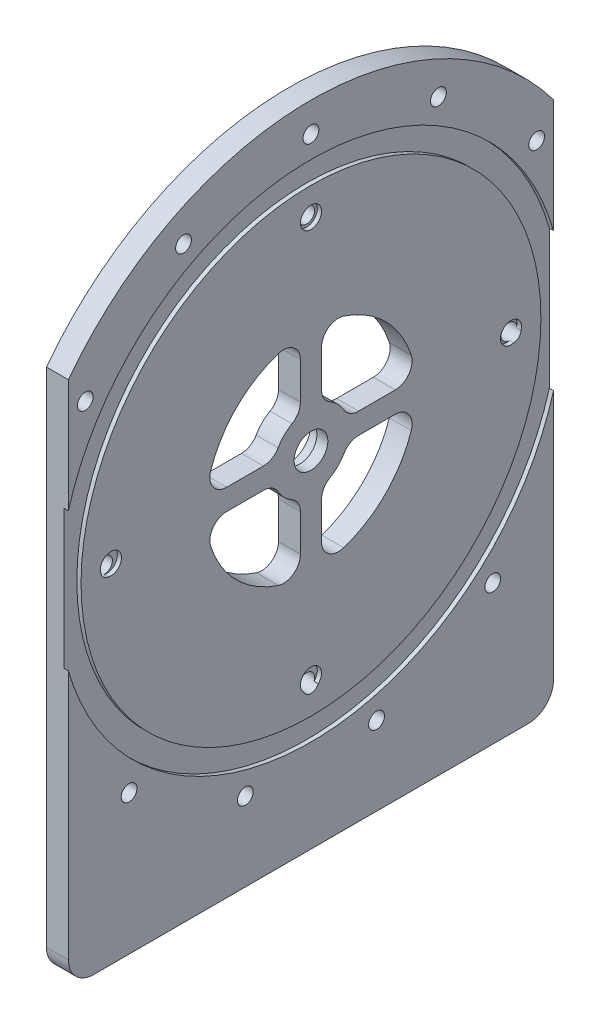
from build123d import *

# Parameters (mm, degrees)
SKETCH1_R           = 5.08
BOSS_EXTRUDE1_DEPTH = 6.604
SKETCH2_R           = 6.477
CUT_EXTRUDE1_DEPTH  = 3.302
SKETCH3_R           = 75.946
SKETCH3_R_2         = 69.215
CUT_EXTRUDE2_DEPTH  = 1.27
SKETCH4_R           = 2.38125
CUT_EXTRUDE3_DEPTH  = 139.530727768
SKETCH10_R          = 57.15
SKETCH10_R_2        = 50.8
CUT_EXTRUDE6_DEPTH  = 1.27
SKETCH12_R          = 2.38125
CUT_EXTRUDE7_DEPTH  = 139.530727768
SKETCH15_R          = 3.175
CUT_EXTRUDE11_DEPTH = 1.27
SKETCH16_W          = 32.206831535
SKETCH16_H          = 125.02997604
SKETCH16_W_2        = 34.902507441
CUT_EXTRUDE12_DEPTH = 139.530727768
CUT_EXTRUDE13_DEPTH = 128.130403763


with BuildPart() as part:
    # Sketch1 → Boss-Extrude1 (new body)
    with BuildSketch(Plane(origin=(0, 0, 0), x_dir=(0, 0, -1), z_dir=(1, 0, 0))):
        with BuildLine():
            Line((-65.405, -103.855072673), (65.405, -103.855072673))
            ThreePointArc((65.405, -103.855072673), (70.793153673, -101.623226346), (73.025, -96.235072673))
            Line((73.025, -96.235072673), (73.025, -69.997049759))
            ThreePointArc((73.025, -69.997049759), (74.696702219, -57.072253546), (79.601785714, -44.998103417))
            ThreePointArc((79.601785714, -44.998103417), (0, 91.44), (-79.601785714, -44.998103417))
            ThreePointArc((-79.601785714, -44.998103417), (-74.696702219, -57.072253546), (-73.025, -69.997049759))
            Line((-73.025, -69.997049759), (-73.025, -96.235072673))
            ThreePointArc((-73.025, -96.235072673), (-70.793153673, -101.623226346), (-65.405, -103.855072673))
        make_face()
        Circle(SKETCH1_R, mode=Mode.SUBTRACT)
    extrude(amount=BOSS_EXTRUDE1_DEPTH)

    # Sketch2 → Cut-Extrude1 (cut)
    with BuildSketch(Plane(origin=(0, 0, 0), x_dir=(0, 0, -1), z_dir=(1, 0, 0))):
        Circle(SKETCH2_R)
    extrude(amount=CUT_EXTRUDE1_DEPTH, mode=Mode.SUBTRACT)

    # Sketch3 → Cut-Extrude2 (cut)
    with BuildSketch(Plane(origin=(6.604, 0, 0), x_dir=(0, 0, -1), z_dir=(1, 0, 0))):
        Circle(SKETCH3_R)
        Circle(SKETCH3_R_2, mode=Mode.SUBTRACT)
    extrude(amount=-CUT_EXTRUDE2_DEPTH, mode=Mode.SUBTRACT)

    # Sketch4 → Cut-Extrude3 (cut, through all)
    with BuildSketch(Plane.ZY):
        with Locations((-38.362897852, 73.094394918)):
            Circle(SKETCH4_R)
        with Locations((0, 82.55)):
            Circle(SKETCH4_R)
        with Locations((38.362897852, 73.094394918)):
            Circle(SKETCH4_R)
        with Locations((67.93731813, 46.893744843)):
            Circle(SKETCH4_R)
        with Locations((81.948117557, 9.950302955)):
            Circle(SKETCH4_R)
        with Locations((77.185590834, -29.272633425)):
            Circle(SKETCH4_R)
        with Locations((54.740775438, -61.789562262)):
            Circle(SKETCH4_R)
        with Locations((19.755508087, -80.151247029)):
            Circle(SKETCH4_R)
        with Locations((-19.755508087, -80.151247029)):
            Circle(SKETCH4_R)
        with Locations((-54.740775438, -61.789562262)):
            Circle(SKETCH4_R)
        with Locations((-77.185590834, -29.272633425)):
            Circle(SKETCH4_R)
        with Locations((-81.948117557, 9.950302955)):
            Circle(SKETCH4_R)
        with Locations((-67.93731813, 46.893744843)):
            Circle(SKETCH4_R)
    extrude(amount=-CUT_EXTRUDE3_DEPTH, mode=Mode.SUBTRACT)

    # Sketch10 → Cut-Extrude6 (cut)
    with BuildSketch(Plane.ZY):
        Circle(SKETCH10_R)
        Circle(SKETCH10_R_2, mode=Mode.SUBTRACT)
    extrude(amount=-CUT_EXTRUDE6_DEPTH, mode=Mode.SUBTRACT)

    # Sketch12 → Cut-Extrude7 (cut, through all)
    with BuildSketch(Plane.ZY):
        with Locations((0, 60.874333344)):
            Circle(SKETCH12_R)
        with Locations((60.874333344, 0)):
            Circle(SKETCH12_R)
        with Locations((0, -60.874333344)):
            Circle(SKETCH12_R)
        with Locations((-60.874333344, 0)):
            Circle(SKETCH12_R)
    extrude(amount=-CUT_EXTRUDE7_DEPTH, mode=Mode.SUBTRACT)

    # Sketch15 → Cut-Extrude11 (cut)
    with BuildSketch(Plane(origin=(6.604, 0, 0), x_dir=(0, 0, -1), z_dir=(1, 0, 0))):
        with Locations((0, 60.874333344)):
            Circle(SKETCH15_R)
        with Locations((60.198, 0.676333344)):
            Circle(SKETCH15_R)
        with Locations((0, -59.521666656)):
            Circle(SKETCH15_R)
        with Locations((-60.198, 0.676333344)):
            Circle(SKETCH15_R)
    extrude(amount=-CUT_EXTRUDE11_DEPTH, mode=Mode.SUBTRACT)

    # Sketch16 → Cut-Extrude12 (cut, through all)
    with BuildSketch(Plane.ZY):
        with Locations((-89.128415768, -7.482061739)):
            Rectangle(SKETCH16_W, SKETCH16_H)
        with Locations((90.476253721, -7.482061739)):
            Rectangle(SKETCH16_W_2, SKETCH16_H)
    extrude(amount=-CUT_EXTRUDE12_DEPTH, mode=Mode.SUBTRACT)

    # Sketch18 → Cut-Extrude13 (cut, through all)
    with BuildSketch(Plane.ZY):
        with BuildLine():
            Line((25.360281446, 3.175), (14.298079416, 3.175))
            ThreePointArc((14.298079416, 3.175), (11.758079416, 3.855590949), (9.898670365, 5.715))
            ThreePointArc((9.898670365, 5.715), (8.082230509, 8.082230509), (5.715, 9.898670365))
            ThreePointArc((5.715, 9.898670365), (3.855590949, 11.758079416), (3.175, 14.298079416))
            Line((3.175, 14.298079416), (3.175, 25.360281446))
            ThreePointArc((3.175, 25.360281446), (5.270146171, 29.470883302), (9.827380952, 30.190811245))
            ThreePointArc((9.827380952, 30.190811245), (22.450640303, 22.450640303), (30.190811245, 9.827380952))
            ThreePointArc((30.190811245, 9.827380952), (29.470883302, 5.270146171), (25.360281446, 3.175))
        make_face()
        with BuildLine():
            Line((-3.175, 25.360281446), (-3.175, 14.298079416))
            ThreePointArc((-3.175, 14.298079416), (-3.855590949, 11.758079416), (-5.715, 9.898670365))
            ThreePointArc((-5.715, 9.898670365), (-8.082230509, 8.082230509), (-9.898670365, 5.715))
            ThreePointArc((-9.898670365, 5.715), (-11.758079416, 3.855590949), (-14.298079416, 3.175))
            Line((-14.298079416, 3.175), (-25.360281446, 3.175))
            ThreePointArc((-25.360281446, 3.175), (-29.470883302, 5.270146171), (-30.190811245, 9.827380952))
            ThreePointArc((-30.190811245, 9.827380952), (-22.450640303, 22.450640303), (-9.827380952, 30.190811245))
            ThreePointArc((-9.827380952, 30.190811245), (-5.270146171, 29.470883302), (-3.175, 25.360281446))
        make_face()
        with BuildLine():
            Line((3.175, -25.360281446), (3.175, -14.298079416))
            ThreePointArc((3.175, -14.298079416), (3.855590949, -11.758079416), (5.715, -9.898670365))
            ThreePointArc((5.715, -9.898670365), (8.082230509, -8.082230509), (9.898670365, -5.715))
            ThreePointArc((9.898670365, -5.715), (11.758079416, -3.855590949), (14.298079416, -3.175))
            Line((14.298079416, -3.175), (25.360281446, -3.175))
            ThreePointArc((25.360281446, -3.175), (29.470883302, -5.270146171), (30.190811245, -9.827380952))
            ThreePointArc((30.190811245, -9.827380952), (22.450640303, -22.450640303), (9.827380952, -30.190811245))
            ThreePointArc((9.827380952, -30.190811245), (5.270146171, -29.470883302), (3.175, -25.360281446))
        make_face()
        with BuildLine():
            Line((-25.360281446, -3.175), (-14.298079416, -3.175))
            ThreePointArc((-14.298079416, -3.175), (-11.758079416, -3.855590949), (-9.898670365, -5.715))
            ThreePointArc((-9.898670365, -5.715), (-8.082230509, -8.082230509), (-5.715, -9.898670365))
            ThreePointArc((-5.715, -9.898670365), (-3.855590949, -11.758079416), (-3.175, -14.298079416))
            Line((-3.175, -14.298079416), (-3.175, -25.360281446))
            ThreePointArc((-3.175, -25.360281446), (-5.270146171, -29.470883302), (-9.827380952, -30.190811245))
            ThreePointArc((-9.827380952, -30.190811245), (-22.450640303, -22.450640303), (-30.190811245, -9.827380952))
            ThreePointArc((-30.190811245, -9.827380952), (-29.470883302, -5.270146171), (-25.360281446, -3.175))
        make_face()
    extrude(amount=-CUT_EXTRUDE13_DEPTH, mode=Mode.SUBTRACT)


solid = part.part
